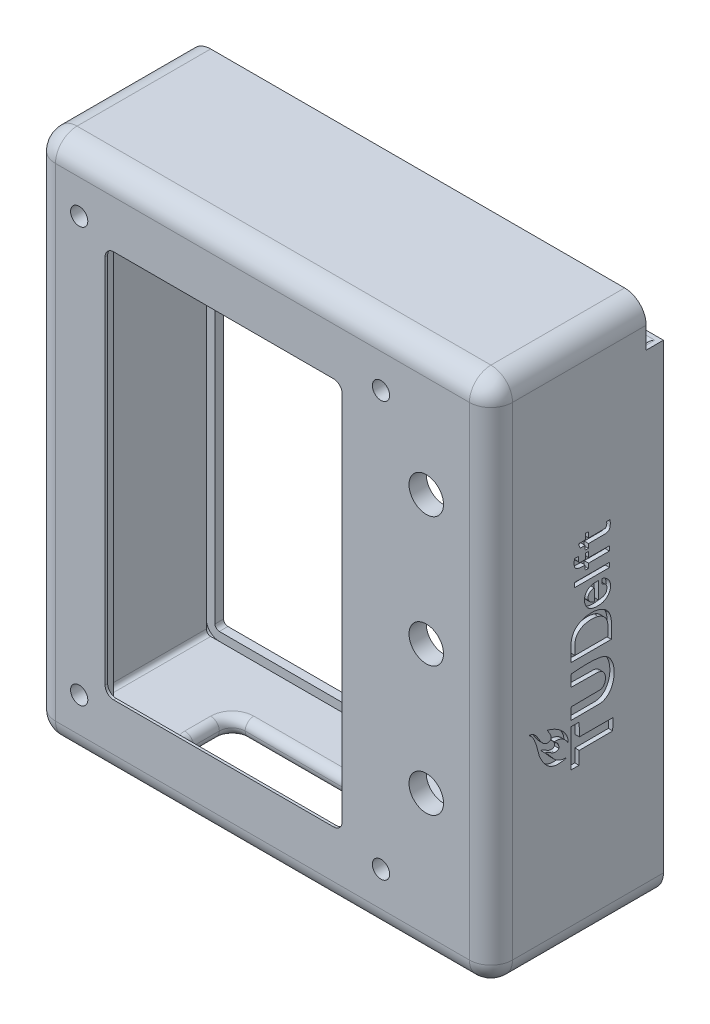
from build123d import *

# Parameters (mm, degrees)
BOSS_EXTRUDE1_DEPTH = 40
SHELL1_T            = -4
SKETCH4_R           = 4
SKETCH4_R_2         = 2
SKETCH4_W           = 59
SKETCH4_H           = 99
CUT_EXTRUDE2_DEPTH  = 10
FILLET10_R          = 5
SKETCH13_W          = 10
SKETCH13_H          = 114
BOSS_EXTRUDE5_DEPTH = 4.5
SKETCH14_R          = 1.65
CUT_EXTRUDE7_DEPTH  = 6
SKETCH17_W          = 102
SKETCH17_H          = 2
CUT_EXTRUDE10_DEPTH = 120
FILLET14_R          = 3
SKETCH18_W          = 98
SKETCH18_H          = 2
CUT_EXTRUDE11_DEPTH = 8.5
CUT_EXTRUDE15_DEPTH = 1
CUT_EXTRUDE13_DEPTH = 1
CUT_EXTRUDE14_DEPTH = 10
SKETCH28_W          = 59
SKETCH28_H          = 99
BOSS_EXTRUDE7_DEPTH = 0.6
SKETCH33_W          = 106
SKETCH33_H          = 2
CUT_EXTRUDE18_DEPTH = 10
SKETCH34_W          = 106
SKETCH34_H          = 2
CUT_EXTRUDE19_DEPTH = 10
FILLET16_R          = 1
FILLET17_R          = 2


with BuildPart() as part:
    # Sketch2 → Boss-Extrude1 (new body)
    with BuildSketch(Plane.XY):
        with BuildLine():
            Line((5, 0), (101, 0))
            ThreePointArc((101, 0), (104.535533906, 1.464466094), (106, 5))
            Line((106, 5), (106, 117))
            ThreePointArc((106, 117), (104.535533906, 120.535533906), (101, 122))
            Line((101, 122), (5, 122))
            ThreePointArc((5, 122), (1.464466094, 120.535533906), (0, 117))
            Line((0, 117), (0, 5))
            ThreePointArc((0, 5), (1.464466094, 1.464466094), (5, 0))
        make_face()
    extrude(amount=-BOSS_EXTRUDE1_DEPTH)

    # Shell1
    shell1_openings = [part.faces().sort_by_distance(p)[0] for p in [
        (53, 61, -40),
    ]]
    offset(amount=SHELL1_T, openings=shell1_openings, kind=Kind.INTERSECTION)

    # Sketch4 → Cut-Extrude2 (cut)
    with BuildSketch(Plane(origin=(0, 0, -4), x_dir=(-1, 0, 0), z_dir=(0, 0, -1))):
        with Locations((-91, 93.5)):
            Circle(SKETCH4_R)
        with Locations((-91, 63.5)):
            Circle(SKETCH4_R)
        with Locations((-91, 33.5)):
            Circle(SKETCH4_R)
        with Locations((-10.5, 13)):
            Circle(SKETCH4_R_2)
        with Locations((-80.5, 13)):
            Circle(SKETCH4_R_2)
        with Locations((-80.5, 109.15)):
            Circle(SKETCH4_R_2)
        with Locations((-10.5, 109.15)):
            Circle(SKETCH4_R_2)
        with Locations((-44, 58.5)):
            Rectangle(SKETCH4_W, SKETCH4_H)
    extrude(amount=-CUT_EXTRUDE2_DEPTH, mode=Mode.SUBTRACT)

    # Fillet10
    fillet10_edges = [part.edges().sort_by_distance(p)[0] for p in [
        (106, 61, 0),
        (104.535533906, 1.464466094, 0),
        (53, 0, 0),
        (1.464466094, 1.464466094, 0),
        (0, 61, 0),
        (1.464466094, 120.535533906, 0),
        (53, 122, 0),
        (104.535533906, 120.535533906, 0),
    ]]
    fillet(fillet10_edges, radius=FILLET10_R)

    # Sketch13 → Boss-Extrude5 (add)
    with BuildSketch(Plane.ZY.offset(-102)):
        with Locations((-9, 61)):
            Rectangle(SKETCH13_W, SKETCH13_H)
    extrude(amount=BOSS_EXTRUDE5_DEPTH)

    # Sketch14 → Cut-Extrude7 (cut)
    with BuildSketch(Plane(origin=(0, 0, -14), x_dir=(-1, 0, 0), z_dir=(0, 0, -1))):
        with Locations(Location((-99.5, 87.5, 0), (0, 0, 90))):
            Circle(SKETCH14_R)
        with Locations(Location((-99.5, 101.5, 0), (0, 0, 90))):
            Circle(SKETCH14_R)
        with Locations(Location((-99.5, 71.5, 0), (0, 0, 90))):
            Circle(SKETCH14_R)
        with Locations(Location((-99.5, 57.5, 0), (0, 0, 90))):
            Circle(SKETCH14_R)
        with Locations(Location((-99.5, 41.5, 0), (0, 0, 90))):
            Circle(SKETCH14_R)
        with Locations(Location((-99.5, 27.5, 0), (0, 0, 90))):
            Circle(SKETCH14_R)
    extrude(amount=-CUT_EXTRUDE7_DEPTH, mode=Mode.SUBTRACT)

    # Sketch17 → Cut-Extrude10 (cut)
    with BuildSketch(Plane(origin=(0, 122, 0), x_dir=(1, 0, 0), z_dir=(0, 1, 0))):
        with Locations((53, 37)):
            Rectangle(SKETCH17_W, SKETCH17_H)
    extrude(amount=-CUT_EXTRUDE10_DEPTH, mode=Mode.SUBTRACT)

    # Fillet14
    fillet14_edges = [part.edges().sort_by_distance(p)[0] for p in [
        (2, 2, -37),
        (104, 2, -37),
    ]]
    fillet(fillet14_edges, radius=FILLET14_R)

    # Sketch18 → Cut-Extrude11 (cut)
    with BuildSketch(Plane(origin=(0, 122, 0), x_dir=(1, 0, 0), z_dir=(0, 1, 0))):
        with Locations((53, 39)):
            Rectangle(SKETCH18_W, SKETCH18_H)
    extrude(amount=-CUT_EXTRUDE11_DEPTH, mode=Mode.SUBTRACT)

    # Sketch29 → Cut-Extrude15 (cut)
    # profile 1 of 7: a face of its own
    with BuildSketch(Plane.ZY):
        Polygon((-19.184615385, 79.668389423), (-19.184615385, 84.690384615), (-21.138461538, 84.690384615), (-21.138461538, 80.080528846), (-22.848076923, 80.080528846), (-22.848076923, 84.690384615), (-25.290384615, 84.690384615), (-25.290384615, 79.435606971), (-27, 79.435606971), (-27, 86.644230769), (-17.475, 86.644230769), (-17.475, 79.668389423), align=None)
    # profile 2 of 7: a face of its own
    with BuildSketch(Plane.ZY):
        with BuildLine():
            add(Edge.make_bspline(
                [(-19.795192308, 75.480213341), (-19.798414928, 75.378875026), (-19.804741596, 75.179927029), (-19.856714567, 74.890208346), (-19.945188898, 74.618168452), (-20.06812969, 74.366222124), (-20.21970016, 74.133175562), (-20.399719628, 73.923376558), (-20.606108876, 73.734353872), (-20.761718003, 73.630611151), (-20.840805288, 73.577884615)],
                knots=[0, 0, 0, 0, 1.070126732, 2.100879305, 3.097489192, 4.083234225, 5.054257209, 6.026534895, 6.996999713, 8, 8, 8, 8], degree=3))
            Line((-20.840805288, 73.577884615), (-17.475, 73.577884615))
            Line((-17.475, 73.577884615), (-17.475, 71.746153846))
            Line((-17.475, 71.746153846), (-27, 71.746153846))
            Line((-27, 71.746153846), (-27, 73.577884615))
            Line((-27, 73.577884615), (-26.015444712, 73.577884615))
            add(Edge.make_bspline(
                [(-26.015444712, 73.577884615), (-26.116760465, 73.641283604), (-26.312037416, 73.76347942), (-26.570438111, 73.973844639), (-26.786662137, 74.196602524), (-26.958497129, 74.437528107), (-27.089110245, 74.701560262), (-27.180260882, 74.992382426), (-27.233289925, 75.312285195), (-27.240494992, 75.534706261), (-27.244230769, 75.650030048)],
                knots=[0, 0, 0, 0, 1.126659371, 2.171534041, 3.134874904, 4.047216994, 4.951512989, 5.902213899, 6.912312383, 8, 8, 8, 8], degree=3))
            add(Edge.make_bspline(
                [(-27.244230769, 75.650030048), (-27.241589264, 75.747549822), (-27.236393908, 75.93935329), (-27.18654429, 76.220410581), (-27.107750531, 76.48969975), (-26.999975154, 76.748444962), (-26.85545235, 76.992735154), (-26.683102461, 77.226304799), (-26.47978733, 77.44899623), (-26.244920941, 77.654822733), (-25.988191568, 77.845151578), (-25.70860854, 78.009589964), (-25.413399026, 78.150996961), (-25.099860632, 78.266396693), (-24.768057068, 78.353558754), (-24.41899819, 78.415658062), (-24.052311923, 78.454923338), (-23.802204717, 78.459935869), (-23.674263822, 78.4625)],
                knots=[0, 0, 0, 0, 0.923362337, 1.816083982, 2.695276275, 3.578446321, 4.464306117, 5.377999886, 6.3250348, 7.315524922, 8.332896985, 9.34892933, 10.384086335, 11.430897423, 12.509764634, 13.630460556, 14.787875807, 16, 16, 16, 16], degree=3))
            add(Edge.make_bspline(
                [(-23.674263822, 78.4625), (-23.527894404, 78.459917745), (-23.242274092, 78.454878821), (-22.826001817, 78.41627175), (-22.433177526, 78.353794916), (-22.063918939, 78.266993029), (-21.718614166, 78.152967953), (-21.398996503, 78.010238844), (-21.100810076, 77.847106747), (-20.830173455, 77.656118163), (-20.588308827, 77.444051189), (-20.373323794, 77.217098732), (-20.194947289, 76.968698659), (-20.049891721, 76.703525166), (-19.932565053, 76.422829589), (-19.855011468, 76.123315222), (-19.802162944, 75.807724359), (-19.797552601, 75.591110239), (-19.795192308, 75.480213341)],
                knots=[0, 0, 0, 0, 1.27570574, 2.489368869, 3.640515872, 4.740475527, 5.792371709, 6.805039957, 7.78776411, 8.750630649, 9.685740783, 10.587928727, 11.469578384, 12.342997146, 13.218103404, 14.11376073, 15.034328495, 16, 16, 16, 16], degree=3))
        make_face()
        with BuildLine():
            add(Edge.make_bspline(
                [(-25.656730769, 75.125315505), (-25.654773554, 75.064173258), (-25.650941774, 74.94447075), (-25.624742834, 74.77062685), (-25.578289562, 74.60877088), (-25.514975689, 74.45776829), (-25.432490802, 74.317649766), (-25.330973974, 74.189301093), (-25.210430478, 74.074101884), (-25.074880215, 73.969182301), (-24.924380835, 73.876285231), (-24.761913747, 73.796284107), (-24.588662384, 73.729378047), (-24.404897402, 73.67427045), (-24.210548414, 73.630115311), (-24.005069435, 73.600550761), (-23.789783972, 73.580457347), (-23.642511366, 73.57875347), (-23.567412861, 73.577884615)],
                knots=[0, 0, 0, 0, 1.001779165, 1.961254029, 2.871652859, 3.754250832, 4.637156362, 5.527411399, 6.426527329, 7.362453559, 8.331221238, 9.319246845, 10.325568759, 11.370642018, 12.460279877, 13.587732286, 14.769915833, 16, 16, 16, 16], degree=3))
            add(Edge.make_bspline(
                [(-23.567412861, 73.577884615), (-23.463697837, 73.579852519), (-23.262903254, 73.583662424), (-22.973006222, 73.608904353), (-22.706435276, 73.657093259), (-22.463108133, 73.7215809), (-22.240989331, 73.802244784), (-22.044107061, 73.906693356), (-21.866643995, 74.02581656), (-21.767415526, 74.123261959), (-21.718509615, 74.171289062)],
                knots=[0, 0, 0, 0, 1.247550769, 2.415285928, 3.495710129, 4.501485712, 5.440734517, 6.330416986, 7.177126502, 8, 8, 8, 8], degree=3))
            add(Edge.make_bspline(
                [(-21.718509615, 74.171289062), (-21.666832064, 74.238268198), (-21.565136807, 74.370075147), (-21.460308872, 74.596324177), (-21.393875572, 74.837220908), (-21.386468525, 75.004023951), (-21.382692308, 75.0890625)],
                knots=[0, 0, 0, 0, 1.014857569, 1.997118619, 2.978902757, 4, 4, 4, 4], degree=3))
            add(Edge.make_bspline(
                [(-21.382692308, 75.0890625), (-21.384401112, 75.153414179), (-21.38771844, 75.278341087), (-21.416870148, 75.458990758), (-21.464253692, 75.626480678), (-21.531429777, 75.780689014), (-21.618052438, 75.921459051), (-21.724205146, 76.048501705), (-21.849460456, 76.16210117), (-21.993457021, 76.259906811), (-22.150080465, 76.347545218), (-22.317253038, 76.423743325), (-22.494643709, 76.485945527), (-22.679483087, 76.540789629), (-22.874605428, 76.578876732), (-23.07804254, 76.611039241), (-23.291111022, 76.62736747), (-23.436371514, 76.629623203), (-23.510171274, 76.630769231)],
                knots=[0, 0, 0, 0, 1.041173403, 2.021245978, 2.953250783, 3.852313722, 4.735255332, 5.619816304, 6.523641978, 7.463293026, 8.431339715, 9.426599799, 10.432928966, 11.472421043, 12.544643625, 13.64838667, 14.805260148, 16, 16, 16, 16], degree=3))
            add(Edge.make_bspline(
                [(-23.510171274, 76.630769231), (-23.589695556, 76.629665664), (-23.744487124, 76.627517607), (-23.970867534, 76.610976353), (-24.184533125, 76.579159764), (-24.387362298, 76.541285608), (-24.576565701, 76.486050046), (-24.75514029, 76.424980144), (-24.919828559, 76.347311578), (-25.072607863, 76.260538762), (-25.210482863, 76.161862108), (-25.330851417, 76.050480764), (-25.430437132, 75.924882683), (-25.513117113, 75.788330315), (-25.579115247, 75.639917783), (-25.624293124, 75.478611297), (-25.651143747, 75.305571861), (-25.654835251, 75.186471377), (-25.656730769, 75.125315505)],
                knots=[0, 0, 0, 0, 1.289049661, 2.50909551, 3.67547421, 4.7895128, 5.850182168, 6.867530038, 7.845350944, 8.796727448, 9.7123533, 10.587623181, 11.445786359, 12.301531035, 13.169300817, 14.069946094, 15.00895339, 16, 16, 16, 16], degree=3))
        make_face(mode=Mode.SUBTRACT)
    # profile 3 of 7: a face of its own
    with BuildSketch(Plane.ZY):
        with BuildLine():
            Line((-19.917307692, 68.204807692), (-24.202794471, 68.204807692))
            add(Edge.make_bspline(
                [(-24.202794471, 68.204807692), (-24.297658216, 68.203123357), (-24.475088099, 68.199973034), (-24.72272805, 68.173514845), (-24.935174198, 68.132115311), (-25.058170166, 68.081301433), (-25.11484375, 68.05788762)],
                knots=[0, 0, 0, 0, 1.222908122, 2.287285243, 3.210822222, 4, 4, 4, 4], degree=3))
            add(Edge.make_bspline(
                [(-25.11484375, 68.05788762), (-25.158371842, 68.035175381), (-25.24329202, 67.990865435), (-25.354271278, 67.900053463), (-25.447791423, 67.794779897), (-25.525972306, 67.674228377), (-25.584817877, 67.537300814), (-25.625959706, 67.384345142), (-25.653769369, 67.216806703), (-25.655722508, 67.099529146), (-25.656730769, 67.03898738)],
                knots=[0, 0, 0, 0, 0.960743248, 1.874341016, 2.793117903, 3.713417485, 4.679731242, 5.702591514, 6.814017171, 8, 8, 8, 8], degree=3))
            add(Edge.make_bspline(
                [(-25.656730769, 67.03898738), (-25.65490278, 66.960596199), (-25.651388504, 66.809890583), (-25.614186658, 66.593125457), (-25.554087107, 66.395682548), (-25.46840452, 66.217479975), (-25.362001403, 66.05596622), (-25.225342328, 65.918487401), (-25.067787519, 65.797793849), (-24.948659497, 65.736552532), (-24.887785457, 65.705258413)],
                knots=[0, 0, 0, 0, 1.149084102, 2.209093249, 3.215506793, 4.167091115, 5.101361966, 6.03837801, 6.997617415, 8, 8, 8, 8], degree=3))
            add(Edge.make_bspline(
                [(-24.887785457, 65.705258413), (-24.813412414, 65.675699586), (-24.656565859, 65.613362479), (-24.394127049, 65.561391973), (-24.100917146, 65.522963035), (-23.893852043, 65.519887195), (-23.784930889, 65.518269231)],
                knots=[0, 0, 0, 0, 0.851258892, 1.795234119, 2.840240881, 4, 4, 4, 4], degree=3))
            Line((-23.784930889, 65.518269231), (-19.917307692, 65.518269231))
            Line((-19.917307692, 65.518269231), (-19.917307692, 63.686538462))
            Line((-19.917307692, 63.686538462), (-27, 63.686538462))
            Line((-27, 63.686538462), (-27, 65.396153846))
            Line((-27, 65.396153846), (-26.015444712, 65.396153846))
            add(Edge.make_bspline(
                [(-26.015444712, 65.396153846), (-26.024280534, 65.402615477), (-26.046508669, 65.418870896), (-26.09054867, 65.445693348), (-26.150539088, 65.483911939), (-26.254299394, 65.545472449), (-26.389288697, 65.636578303), (-26.481185871, 65.730929335), (-26.526802885, 65.777764423)],
                knots=[0, 0, 0, 0, 0.307561016, 0.773726258, 1.448317077, 2.306767232, 4.166709159, 6, 6, 6, 6], degree=3))
            add(Edge.make_bspline(
                [(-26.526802885, 65.777764423), (-26.591593938, 65.849247195), (-26.715945558, 65.986442038), (-26.876304593, 66.200576781), (-27.000339352, 66.413376829), (-27.097910936, 66.624264691), (-27.16561395, 66.843895403), (-27.209317846, 67.077019275), (-27.239490087, 67.326960092), (-27.24261507, 67.499367439), (-27.244230769, 67.588506611)],
                knots=[0, 0, 0, 0, 1.154390067, 2.215587905, 3.194791368, 4.097601241, 4.990860715, 5.937383724, 6.933572677, 8, 8, 8, 8], degree=3))
            add(Edge.make_bspline(
                [(-27.244230769, 67.588506611), (-27.240687348, 67.71591366), (-27.233882809, 67.96057725), (-27.178799966, 68.312277053), (-27.084004493, 68.630894331), (-26.950837729, 68.917539436), (-26.782073258, 69.17398088), (-26.571193341, 69.394614336), (-26.323188836, 69.583827803), (-26.136099053, 69.678785341), (-26.040249399, 69.727433894)],
                knots=[0, 0, 0, 0, 1.171379334, 2.249434986, 3.263558756, 4.218762828, 5.146766563, 6.073626549, 7.013082238, 8, 8, 8, 8], degree=3))
            add(Edge.make_bspline(
                [(-26.040249399, 69.727433894), (-25.985297918, 69.752535858), (-25.871588206, 69.804478717), (-25.686188332, 69.866927177), (-25.48262132, 69.919341942), (-25.261056037, 69.963735034), (-25.021205466, 69.994441957), (-24.763625466, 70.020473842), (-24.486565591, 70.032350077), (-24.295658883, 70.035112093), (-24.197070313, 70.036538462)],
                knots=[0, 0, 0, 0, 0.769276275, 1.591843974, 2.488062962, 3.446313095, 4.468516516, 5.567486281, 6.743794526, 8, 8, 8, 8], degree=3))
            Line((-24.197070313, 70.036538462), (-19.917307692, 70.036538462))
            Line((-19.917307692, 70.036538462), (-19.917307692, 68.204807692))
        make_face()
    # profile 4 of 7: a face of its own
    with BuildSketch(Plane.ZY):
        with BuildLine():
            add(Edge.make_bspline(
                [(-20.556505409, 54.65), (-20.694638234, 54.652306363), (-20.961348512, 54.656759546), (-21.345213517, 54.697911096), (-21.699054434, 54.760387418), (-22.020378986, 54.854260249), (-22.311827896, 54.971961113), (-22.570972055, 55.117379685), (-22.800420138, 55.288438792), (-22.99563008, 55.48911555), (-23.163054459, 55.714420889), (-23.30797716, 55.96086543), (-23.430221478, 56.230438219), (-23.531232621, 56.520968773), (-23.609573163, 56.834493463), (-23.663762774, 57.170238187), (-23.696315115, 57.528608255), (-23.700652479, 57.77468416), (-23.702884615, 57.901322115)],
                knots=[0, 0, 0, 0, 1.269715031, 2.451597213, 3.545878933, 4.569310324, 5.523925967, 6.429940895, 7.294304972, 8.146214302, 8.994200311, 9.869807726, 10.770047517, 11.711459089, 12.694405657, 13.737564152, 14.835683444, 16, 16, 16, 16], degree=3))
            Line((-23.702884615, 57.901322115), (-23.702884615, 59.900961538))
            Line((-23.702884615, 59.900961538), (-27, 59.900961538))
            Line((-27, 59.900961538), (-27, 61.854807692))
            Line((-27, 61.854807692), (-17.475, 61.854807692))
            Line((-17.475, 61.854807692), (-17.475, 57.754402043))
            add(Edge.make_bspline(
                [(-17.475, 57.754402043), (-17.476861599, 57.639168324), (-17.480502014, 57.413825134), (-17.518690142, 57.085573755), (-17.574303552, 56.774323364), (-17.656118398, 56.481434648), (-17.763808447, 56.207018874), (-17.893881771, 55.949990517), (-18.046749084, 55.710450936), (-18.223135956, 55.489775539), (-18.422786497, 55.289087943), (-18.653311612, 55.119402037), (-18.906772119, 54.972535228), (-19.188157049, 54.85521299), (-19.493980376, 54.760914014), (-19.82623681, 54.698387901), (-20.182742256, 54.656760096), (-20.429173082, 54.652303006), (-20.556505409, 54.65)],
                knots=[0, 0, 0, 0, 1.107803273, 2.166344416, 3.174163336, 4.146339712, 5.085767764, 6.004962551, 6.912790486, 7.813667173, 8.717695093, 9.626696984, 10.558425905, 11.528714446, 12.552319343, 13.630821504, 14.775830874, 16, 16, 16, 16], degree=3))
        make_face()
        with BuildLine():
            add(Edge.make_bspline(
                [(-20.562229567, 56.603846154), (-20.502362836, 56.604585828), (-20.386751094, 56.606014252), (-20.220641016, 56.627012908), (-20.066310388, 56.652804978), (-19.927273255, 56.698586332), (-19.799272196, 56.750622006), (-19.686168951, 56.818320043), (-19.585675006, 56.896809119), (-19.469626293, 57.018983418), (-19.351241098, 57.202228636), (-19.252868818, 57.458812823), (-19.193550785, 57.752990098), (-19.187696141, 57.9614472), (-19.184615385, 58.071138822)],
                knots=[0, 0, 0, 0, 0.930183877, 1.796326194, 2.601357612, 3.358355334, 4.067445477, 4.745939225, 5.400884009, 6.044453304, 7.358443859, 8.761645878, 10.295954839, 12, 12, 12, 12], degree=3))
            Line((-19.184615385, 58.071138822), (-19.184615385, 59.900961538))
            Line((-19.184615385, 59.900961538), (-21.993269231, 59.900961538))
            Line((-21.993269231, 59.900961538), (-21.993269231, 58.071138822))
            add(Edge.make_bspline(
                [(-21.993269231, 58.071138822), (-21.992088087, 58.014497039), (-21.989800951, 57.904817343), (-21.974468427, 57.744702597), (-21.948704405, 57.594460203), (-21.909310218, 57.45387109), (-21.86303098, 57.322100773), (-21.803169213, 57.200596215), (-21.732033027, 57.089854552), (-21.652133638, 56.98762694), (-21.559484571, 56.89670663), (-21.453383658, 56.8182149), (-21.334994812, 56.751028888), (-21.20339986, 56.698909864), (-21.06194348, 56.652772669), (-20.905713691, 56.627034452), (-20.738334399, 56.606090658), (-20.622094232, 56.604609145), (-20.562229567, 56.603846154)],
                knots=[0, 0, 0, 0, 1.157083971, 2.240547754, 3.283033291, 4.266518188, 5.220107684, 6.132437237, 7.026352878, 7.905029121, 8.777922001, 9.669284267, 10.594385861, 11.549920919, 12.556817322, 13.627190485, 14.777983127, 16, 16, 16, 16], degree=3))
        make_face(mode=Mode.SUBTRACT)
    # profile 5 of 7: a face of its own
    with BuildSketch(Plane.ZY):
        with BuildLine():
            add(Edge.make_bspline(
                [(-22.808007812, 50.286283053), (-22.797021673, 50.206710525), (-22.776667441, 50.059284967), (-22.742025965, 49.856926435), (-22.70143694, 49.690625172), (-22.665670795, 49.594685499), (-22.649639423, 49.551682692)],
                knots=[0, 0, 0, 0, 1.279335821, 2.370250185, 3.269501206, 4, 4, 4, 4], degree=3))
            add(Edge.make_bspline(
                [(-22.649639423, 49.551682692), (-22.620775432, 49.491976366), (-22.56713145, 49.381011633), (-22.446610047, 49.24911033), (-22.298008897, 49.168118111), (-22.189478821, 49.159285118), (-22.134465144, 49.154807692)],
                knots=[0, 0, 0, 0, 1.145385502, 2.128709049, 3.051446389, 4, 4, 4, 4], degree=3))
            add(Edge.make_bspline(
                [(-22.134465144, 49.154807692), (-22.068365112, 49.157645196), (-21.943873207, 49.162989311), (-21.773979634, 49.22454535), (-21.634071769, 49.322355272), (-21.535284244, 49.467143136), (-21.467279223, 49.645449191), (-21.416384081, 49.857095361), (-21.386886342, 50.104833218), (-21.384149683, 50.281747779), (-21.382692308, 50.375961538)],
                knots=[0, 0, 0, 0, 0.965897861, 1.81915896, 2.614502876, 3.430446704, 4.347343387, 5.404533633, 6.617815053, 8, 8, 8, 8], degree=3))
            add(Edge.make_bspline(
                [(-21.382692308, 50.375961538), (-21.383850993, 50.430063264), (-21.386091408, 50.534673482), (-21.401472918, 50.685171143), (-21.425453132, 50.824009337), (-21.461599765, 50.949934174), (-21.507742514, 51.063745607), (-21.562436105, 51.166054466), (-21.629951348, 51.25513335), (-21.682819981, 51.305216393), (-21.708969351, 51.329987981)],
                knots=[0, 0, 0, 0, 1.248984466, 2.415016093, 3.489417099, 4.497974738, 5.43331642, 6.320501474, 7.169302748, 8, 8, 8, 8], degree=3))
            add(Edge.make_bspline(
                [(-21.708969351, 51.329987981), (-21.752043521, 51.361772195), (-21.840495817, 51.427040702), (-21.994006675, 51.503844884), (-22.169381282, 51.560193125), (-22.294428124, 51.584463284), (-22.359615385, 51.597115385)],
                knots=[0, 0, 0, 0, 0.901944212, 1.852131727, 2.880310388, 4, 4, 4, 4], degree=3))
            Line((-22.359615385, 51.597115385), (-22.359615385, 53.428846154))
            add(Edge.make_bspline(
                [(-22.359615385, 53.428846154), (-22.280626976, 53.422954056), (-22.125900102, 53.411412287), (-21.89994756, 53.375672222), (-21.684142357, 53.331087764), (-21.479358084, 53.271820075), (-21.285385564, 53.199095627), (-21.102697623, 53.112932239), (-20.929142889, 53.016561305), (-20.822950371, 52.940166737), (-20.770207332, 52.902223558)],
                knots=[0, 0, 0, 0, 1.118691807, 2.191355533, 3.229471641, 4.230560278, 5.200302684, 6.153074968, 7.082680764, 8, 8, 8, 8], degree=3))
            add(Edge.make_bspline(
                [(-20.770207332, 52.902223558), (-20.691661811, 52.837116822), (-20.53372358, 52.706201111), (-20.335356604, 52.465454629), (-20.16806222, 52.192600178), (-20.030807258, 51.887284087), (-19.92444348, 51.549039918), (-19.849130842, 51.178193302), (-19.803083404, 50.773996942), (-19.797888484, 50.493117735), (-19.795192308, 50.347340745)],
                knots=[0, 0, 0, 0, 0.862285428, 1.733871429, 2.626143069, 3.566140153, 4.560811269, 5.622301099, 6.765968497, 8, 8, 8, 8], degree=3))
            add(Edge.make_bspline(
                [(-19.795192308, 50.347340745), (-19.796442009, 50.250605926), (-19.798912788, 50.059352005), (-19.825105891, 49.776563865), (-19.86433024, 49.501849356), (-19.920613969, 49.235079326), (-19.989360876, 48.97612851), (-20.079524139, 48.72662882), (-20.180284656, 48.483575321), (-20.2632599, 48.329260592), (-20.304642428, 48.252298678)],
                knots=[0, 0, 0, 0, 1.064896591, 2.105401667, 3.124569576, 4.119013565, 5.106105961, 6.071874617, 7.038379406, 8, 8, 8, 8], degree=3))
            add(Edge.make_bspline(
                [(-20.304642428, 48.252298678), (-20.349111449, 48.179702925), (-20.436731185, 48.036663555), (-20.600439705, 47.848160819), (-20.788631563, 47.690125091), (-20.997872977, 47.558410865), (-21.232920881, 47.459613783), (-21.489041878, 47.386930035), (-21.768695593, 47.345479119), (-21.961969055, 47.339517525), (-22.061959135, 47.336433293)],
                knots=[0, 0, 0, 0, 0.977845014, 1.926701331, 2.855729463, 3.79540747, 4.758700572, 5.777461224, 6.850168949, 8, 8, 8, 8], degree=3))
            Line((-22.061959135, 47.336433293), (-25.225510817, 47.336433293))
            add(Edge.make_bspline(
                [(-25.225510817, 47.336433293), (-25.283391635, 47.336741321), (-25.404890465, 47.33738791), (-25.595664021, 47.33200787), (-25.803672458, 47.329204596), (-25.948030567, 47.325172867), (-26.023076923, 47.323076923)],
                knots=[0, 0, 0, 0, 0.870654108, 1.827608197, 2.87065514, 4, 4, 4, 4], degree=3))
            add(Edge.make_bspline(
                [(-26.023076923, 47.323076923), (-26.081091829, 47.319775659), (-26.186759185, 47.313762792), (-26.330021318, 47.289771647), (-26.445183908, 47.263146837), (-26.557362278, 47.208377434), (-26.668391091, 47.109845512), (-26.725547943, 47.009688234), (-26.755769231, 46.956730769)],
                knots=[0, 0, 0, 0, 1.199216845, 2.184233055, 3.000145829, 3.628917492, 4.746306586, 6, 6, 6, 6], degree=3))
            Line((-26.755769231, 46.956730769), (-27, 46.956730769))
            Line((-27, 46.956730769), (-27, 48.983082933))
            add(Edge.make_bspline(
                [(-27, 48.983082933), (-26.917767881, 49.008989688), (-26.760044061, 49.058679668), (-26.517807806, 49.104103068), (-26.268522392, 49.135022215), (-26.09693056, 49.14794984), (-26.005904447, 49.154807692)],
                knots=[0, 0, 0, 0, 1.021624659, 1.959508582, 2.917559194, 4, 4, 4, 4], degree=3))
            add(Edge.make_bspline(
                [(-26.005904447, 49.154807692), (-26.085141091, 49.219170699), (-26.242619912, 49.347088918), (-26.46027656, 49.558697531), (-26.662531716, 49.783002098), (-26.780678571, 49.945552026), (-26.839723558, 50.026787861)],
                knots=[0, 0, 0, 0, 1.011222501, 2.009753563, 3.005355878, 4, 4, 4, 4], degree=3))
            add(Edge.make_bspline(
                [(-26.839723558, 50.026787861), (-26.902423, 50.126729593), (-27.026906258, 50.325153569), (-27.150816492, 50.655497646), (-27.231341297, 51.002347825), (-27.239888269, 51.241113892), (-27.244230769, 51.36242488)],
                knots=[0, 0, 0, 0, 0.997301731, 1.980039463, 2.973709247, 4, 4, 4, 4], degree=3))
            add(Edge.make_bspline(
                [(-27.244230769, 51.36242488), (-27.243214541, 51.440117281), (-27.241225574, 51.592177246), (-27.212420282, 51.814596979), (-27.171757741, 52.027481196), (-27.111864498, 52.22953127), (-27.038560811, 52.422371488), (-26.943207653, 52.601924434), (-26.834429147, 52.773082004), (-26.709099013, 52.932747737), (-26.568245659, 53.078666213), (-26.410767781, 53.204895129), (-26.239805411, 53.312314122), (-26.055785042, 53.401093693), (-25.856607035, 53.467073692), (-25.644845796, 53.517309589), (-25.417724016, 53.545750525), (-25.261841098, 53.549191073), (-25.181625601, 53.550961538)],
                knots=[0, 0, 0, 0, 1.097748341, 2.148518655, 3.166171021, 4.159369777, 5.124652968, 6.077964498, 7.028429744, 7.989135819, 8.943083412, 9.889711825, 10.835357215, 11.792690014, 12.770997637, 13.796251028, 14.865976971, 16, 16, 16, 16], degree=3))
            add(Edge.make_bspline(
                [(-25.181625601, 53.550961538), (-25.07838376, 53.548423826), (-24.878346969, 53.543506868), (-24.590074679, 53.494455593), (-24.32291638, 53.416473171), (-24.077778025, 53.305988924), (-23.85460895, 53.162599963), (-23.655362492, 52.987235192), (-23.476592625, 52.780847389), (-23.380184632, 52.623888123), (-23.330814303, 52.543509615)],
                knots=[0, 0, 0, 0, 1.115790059, 2.161905088, 3.152248555, 4.118967279, 5.059710258, 6.010361337, 6.981110261, 8, 8, 8, 8], degree=3))
            add(Edge.make_bspline(
                [(-23.330814303, 52.543509615), (-23.304505502, 52.494954986), (-23.250208327, 52.39474596), (-23.182887735, 52.230264049), (-23.1179888, 52.051602027), (-23.058252574, 51.856335549), (-23.00849802, 51.644218847), (-22.959948278, 51.416725198), (-22.918336859, 51.172882777), (-22.89587417, 51.004424339), (-22.884329928, 50.917848558)],
                knots=[0, 0, 0, 0, 0.781113815, 1.612094545, 2.511948196, 3.471636916, 4.500010533, 5.594649795, 6.763819266, 8, 8, 8, 8], degree=3))
            Line((-22.884329928, 50.917848558), (-22.808007812, 50.286283053))
        make_face()
        with BuildLine():
            add(Edge.make_bspline(
                [(-23.569320913, 49.160531851), (-23.600110509, 49.220514665), (-23.660622882, 49.338401966), (-23.724064339, 49.494057317), (-23.764486376, 49.629085001), (-23.792491394, 49.747039809), (-23.819122899, 49.882088876), (-23.835411587, 49.977772492), (-23.844080529, 50.028695913)],
                knots=[0, 0, 0, 0, 1.324711271, 2.603523031, 3.295464343, 4.092720472, 4.984933851, 6, 6, 6, 6], degree=3))
            Line((-23.844080529, 50.028695913), (-23.914678486, 50.45609976))
            add(Edge.make_bspline(
                [(-23.914678486, 50.45609976), (-23.93031234, 50.549142805), (-23.95924491, 50.721331596), (-24.011893416, 50.955996148), (-24.067704771, 51.147890224), (-24.118929612, 51.255405515), (-24.141736779, 51.30327524)],
                knots=[0, 0, 0, 0, 1.285508128, 2.379007392, 3.278275014, 4, 4, 4, 4], degree=3))
            add(Edge.make_bspline(
                [(-24.141736779, 51.30327524), (-24.161217428, 51.336310087), (-24.199092456, 51.400537706), (-24.269366827, 51.485060481), (-24.345648041, 51.559089962), (-24.431544426, 51.618108567), (-24.525833396, 51.662971299), (-24.626785055, 51.694323415), (-24.735389036, 51.717425417), (-24.810695299, 51.718615542), (-24.849624399, 51.719230769)],
                knots=[0, 0, 0, 0, 1.061155753, 2.063139793, 3.035545394, 3.998642392, 4.936740835, 5.917733668, 6.92358549, 8, 8, 8, 8], degree=3))
            add(Edge.make_bspline(
                [(-24.849624399, 51.719230769), (-24.91609306, 51.716173551), (-25.041600439, 51.710400854), (-25.21643433, 51.661270656), (-25.3614376, 51.574859047), (-25.473223828, 51.455444249), (-25.554296546, 51.313392131), (-25.613836938, 51.156938252), (-25.651140507, 50.985728081), (-25.654833275, 50.866524903), (-25.656730769, 50.805273437)],
                knots=[0, 0, 0, 0, 1.151618787, 2.174508307, 3.114822681, 4.043415227, 4.978082406, 5.934884088, 6.938859042, 8, 8, 8, 8], degree=3))
            add(Edge.make_bspline(
                [(-25.656730769, 50.805273437), (-25.653277509, 50.706399156), (-25.646440611, 50.510644077), (-25.585123231, 50.223151846), (-25.483950043, 49.948627385), (-25.372372054, 49.729625137), (-25.258069392, 49.568817626), (-25.152236418, 49.464168445), (-25.03153503, 49.374205006), (-24.894115649, 49.299207807), (-24.740880805, 49.239912727), (-24.570656901, 49.199340387), (-24.385645638, 49.169863004), (-24.256341034, 49.163713592), (-24.189438101, 49.160531851)],
                knots=[0, 0, 0, 0, 1.424634298, 2.820545406, 4.216185285, 5.63573201, 6.351216174, 7.051668355, 7.772599332, 8.515597679, 9.302531378, 10.134519022, 11.034789597, 12, 12, 12, 12], degree=3))
            Line((-24.189438101, 49.160531851), (-23.569320913, 49.160531851))
        make_face(mode=Mode.SUBTRACT)
    # profile 6 of 7: a face of its own
    with BuildSketch(Plane.ZY):
        with BuildLine():
            add(Edge.make_bspline(
                [(-22.481730769, 41.705769231), (-22.419047984, 41.717011971), (-22.295720596, 41.739131885), (-22.117415735, 41.79787435), (-21.948645402, 41.877008314), (-21.846125389, 41.94727866), (-21.794831731, 41.982436899)],
                knots=[0, 0, 0, 0, 1.020784564, 2.008377456, 3.003534999, 4, 4, 4, 4], degree=3))
            add(Edge.make_bspline(
                [(-21.794831731, 41.982436899), (-21.761629078, 42.010889044), (-21.695863438, 42.067245188), (-21.610409725, 42.166362148), (-21.540296658, 42.277458464), (-21.482730189, 42.399411442), (-21.43653216, 42.531637734), (-21.404852081, 42.675091544), (-21.385149685, 42.829695757), (-21.383532108, 42.936399391), (-21.382692308, 42.991796875)],
                knots=[0, 0, 0, 0, 0.927730938, 1.837588673, 2.766891705, 3.709451669, 4.696271124, 5.735065912, 6.824110798, 8, 8, 8, 8], degree=3))
            add(Edge.make_bspline(
                [(-21.382692308, 42.991796875), (-21.384860431, 43.070239638), (-21.389037257, 43.221357309), (-21.432296285, 43.438701232), (-21.502331706, 43.636547269), (-21.601591065, 43.815796667), (-21.728333174, 43.97540046), (-21.884233408, 44.114406629), (-22.067513161, 44.234356691), (-22.204677954, 44.294435115), (-22.275661058, 44.325525841)],
                knots=[0, 0, 0, 0, 1.094180442, 2.107906356, 3.079923282, 4.014160969, 4.955966861, 5.91186353, 6.919384453, 8, 8, 8, 8], degree=3))
            add(Edge.make_bspline(
                [(-22.275661058, 44.325525841), (-22.362877741, 44.354940816), (-22.547840118, 44.417321812), (-22.853275076, 44.472085378), (-23.196930958, 44.509599852), (-23.439446525, 44.51275711), (-23.567412861, 44.514423077)],
                knots=[0, 0, 0, 0, 0.840821226, 1.783148432, 2.830250876, 4, 4, 4, 4], degree=3))
            add(Edge.make_bspline(
                [(-23.567412861, 44.514423077), (-23.689028701, 44.512750036), (-23.92014177, 44.509570668), (-24.247871579, 44.471896827), (-24.540454915, 44.417667142), (-24.716686769, 44.353811059), (-24.800015024, 44.323617788)],
                knots=[0, 0, 0, 0, 1.162699392, 2.209539676, 3.153411088, 4, 4, 4, 4], degree=3))
            add(Edge.make_bspline(
                [(-24.800015024, 44.323617788), (-24.867942538, 44.293938219), (-24.999858842, 44.236300027), (-25.174012629, 44.116776526), (-25.326691288, 43.98387906), (-25.447144386, 43.826438525), (-25.54306736, 43.651781572), (-25.608647411, 43.457323148), (-25.650019702, 43.244132025), (-25.654435575, 43.095672805), (-25.656730769, 43.018509615)],
                knots=[0, 0, 0, 0, 1.062283379, 2.062971077, 3.020279789, 3.957595583, 4.893619787, 5.869999752, 6.892910715, 8, 8, 8, 8], degree=3))
            add(Edge.make_bspline(
                [(-25.656730769, 43.018509615), (-25.655523242, 42.963779335), (-25.653187517, 42.857914342), (-25.638434293, 42.705306375), (-25.612304118, 42.565204041), (-25.573668793, 42.438215145), (-25.525976307, 42.323043523), (-25.469372158, 42.218777423), (-25.399511684, 42.127725871), (-25.291726053, 42.02358252), (-25.13418682, 41.917279346), (-24.924369551, 41.815062512), (-24.688808281, 41.741707572), (-24.52191321, 41.71802199), (-24.435576923, 41.705769231)],
                knots=[0, 0, 0, 0, 0.976560142, 1.888964051, 2.732498075, 3.515129688, 4.252778793, 4.953815319, 5.625677932, 6.291765114, 7.62030924, 8.995767327, 10.445884044, 12, 12, 12, 12], degree=3))
            Line((-24.435576923, 41.705769231), (-24.435576923, 39.874038462))
            add(Edge.make_bspline(
                [(-24.435576923, 39.874038462), (-24.505727089, 39.880345927), (-24.645628095, 39.892924954), (-24.85227622, 39.935537489), (-25.056832973, 39.987510916), (-25.257530868, 40.057922825), (-25.457086935, 40.138482206), (-25.651177892, 40.239880567), (-25.845004091, 40.350997519), (-25.968360521, 40.437219634), (-26.030709135, 40.480799279)],
                knots=[0, 0, 0, 0, 0.977261134, 1.948959257, 2.925781307, 3.906110522, 4.900030829, 5.911184547, 6.944240298, 8, 8, 8, 8], degree=3))
            add(Edge.make_bspline(
                [(-26.030709135, 40.480799279), (-26.127645209, 40.554628308), (-26.318826251, 40.70023675), (-26.565753185, 40.960316976), (-26.777937666, 41.243027796), (-26.948408378, 41.554657097), (-27.083392279, 41.889932466), (-27.175155714, 42.25262838), (-27.234303651, 42.640043186), (-27.24085928, 42.907613702), (-27.244230769, 43.045222356)],
                knots=[0, 0, 0, 0, 0.988134944, 1.948837625, 2.901271395, 3.851433691, 4.82493564, 5.828394326, 6.883166437, 8, 8, 8, 8], degree=3))
            add(Edge.make_bspline(
                [(-27.244230769, 43.045222356), (-27.241906115, 43.182153429), (-27.237391589, 43.448076412), (-27.185382617, 43.831519232), (-27.109393804, 44.189151161), (-26.996479107, 44.517339554), (-26.85322766, 44.819746666), (-26.674074517, 45.090852743), (-26.466961826, 45.337628246), (-26.224355132, 45.550149783), (-25.95800057, 45.735683415), (-25.675660442, 45.901363488), (-25.374046488, 46.038425445), (-25.055595657, 46.151731141), (-24.719585123, 46.23853033), (-24.366372421, 46.302228511), (-23.995547022, 46.337760439), (-23.742389883, 46.343317917), (-23.61320613, 46.346153846)],
                knots=[0, 0, 0, 0, 1.177156206, 2.286061753, 3.322822893, 4.317722961, 5.264773922, 6.193503842, 7.105646802, 8.028021187, 8.958554405, 9.895100176, 10.840125967, 11.804032814, 12.799339004, 13.822131939, 14.88865402, 16, 16, 16, 16], degree=3))
            add(Edge.make_bspline(
                [(-23.61320613, 46.346153846), (-23.468076743, 46.34394138), (-23.185443077, 46.339632691), (-22.773594123, 46.296015581), (-22.385246225, 46.229164283), (-22.021373829, 46.131573064), (-21.681552449, 46.007236192), (-21.364903886, 45.856887095), (-21.072822514, 45.676787778), (-20.807985985, 45.467946344), (-20.568470415, 45.237919414), (-20.360737133, 44.984367115), (-20.186297791, 44.709062967), (-20.04192715, 44.413730072), (-19.932040971, 44.09689107), (-19.851290278, 43.760272089), (-19.803054256, 43.402159703), (-19.797855506, 43.156039542), (-19.795192308, 43.029957933)],
                knots=[0, 0, 0, 0, 1.216174426, 2.368450963, 3.467650265, 4.516510274, 5.521821814, 6.497166983, 7.45001556, 8.391791627, 9.319334404, 10.228647329, 11.132347255, 12.045606105, 12.978085134, 13.937607724, 14.943484617, 16, 16, 16, 16], degree=3))
            add(Edge.make_bspline(
                [(-19.795192308, 43.029957933), (-19.797163451, 42.9224244), (-19.801018691, 42.712106074), (-19.827112259, 42.403345555), (-19.875011008, 42.110211942), (-19.940352019, 41.831733667), (-20.020888102, 41.567171374), (-20.125114642, 41.318982971), (-20.245254907, 41.0847995), (-20.384071613, 40.865745538), (-20.547816098, 40.664423263), (-20.739667251, 40.483963145), (-20.961050693, 40.327164887), (-21.21091916, 40.193148729), (-21.487558122, 40.078856613), (-21.794010065, 39.988000796), (-22.127793318, 39.917352776), (-22.361244098, 39.888783433), (-22.481730769, 39.874038462)],
                knots=[0, 0, 0, 0, 1.106029885, 2.163216879, 3.183825836, 4.158098972, 5.103662189, 6.024531847, 6.922747049, 7.808295155, 8.686954375, 9.584764519, 10.508719332, 11.468833984, 12.495379681, 13.581872002, 14.75197593, 16, 16, 16, 16], degree=3))
            Line((-22.481730769, 39.874038462), (-22.481730769, 41.705769231))
        make_face()
    # profile 7 of 7: a face of its own
    with BuildSketch(Plane.ZY):
        with BuildLine():
            add(Edge.make_bspline(
                [(-19.795192308, 35.792713341), (-19.799470709, 35.64943399), (-19.807855914, 35.368621922), (-19.866450083, 34.957186776), (-19.971110831, 34.568955617), (-20.087867236, 34.260745335), (-20.204912219, 34.029779913), (-20.303048029, 33.863614282), (-20.413039107, 33.70575005), (-20.536830761, 33.556438993), (-20.669329718, 33.412945246), (-20.816402775, 33.278929606), (-20.973169277, 33.151198852), (-21.085736633, 33.074234861), (-21.142277644, 33.035576923)],
                knots=[0, 0, 0, 0, 1.608362333, 3.15221661, 4.651988969, 6.114453022, 6.842462457, 7.556330322, 8.279280659, 8.999652744, 9.732129822, 10.469842536, 11.231423273, 12, 12, 12, 12], degree=3))
            add(Edge.make_bspline(
                [(-21.142277644, 33.035576923), (-21.247743066, 32.970069562), (-21.460457496, 32.837947009), (-21.808813086, 32.684562906), (-22.181242898, 32.566212541), (-22.44098568, 32.519431552), (-22.573317308, 32.495597957)],
                knots=[0, 0, 0, 0, 0.965490094, 1.94730814, 2.954211348, 4, 4, 4, 4], degree=3))
            add(Edge.make_bspline(
                [(-22.573317308, 32.495597957), (-22.661627786, 32.484386725), (-22.854900687, 32.459850256), (-23.172912242, 32.444060349), (-23.542537544, 32.433680282), (-23.806544746, 32.436731663), (-23.947115385, 32.43835637)],
                knots=[0, 0, 0, 0, 0.77593598, 1.698183515, 2.774397778, 4, 4, 4, 4], degree=3))
            Line((-23.947115385, 32.43835637), (-23.947115385, 37.309615385))
            add(Edge.make_bspline(
                [(-23.947115385, 37.309615385), (-24.029986889, 37.304988936), (-24.190915102, 37.296004833), (-24.421207858, 37.254529127), (-24.633804513, 37.198943648), (-24.825885861, 37.119992066), (-24.999359809, 37.022394855), (-25.153418853, 36.905544201), (-25.287562681, 36.768171003), (-25.36045944, 36.663881623), (-25.397235577, 36.611268029)],
                knots=[0, 0, 0, 0, 1.186462669, 2.303992399, 3.341523905, 4.325013182, 5.266342964, 6.181807089, 7.08272862, 8, 8, 8, 8], degree=3))
            add(Edge.make_bspline(
                [(-25.397235577, 36.611268029), (-25.436998545, 36.542385354), (-25.517667931, 36.402639168), (-25.598841076, 36.168359222), (-25.646614438, 35.914244953), (-25.653294758, 35.738232844), (-25.656730769, 35.647701322)],
                knots=[0, 0, 0, 0, 0.942300318, 1.911698055, 2.925885537, 4, 4, 4, 4], degree=3))
            add(Edge.make_bspline(
                [(-25.656730769, 35.647701322), (-25.653347277, 35.552591831), (-25.646857458, 35.370163903), (-25.589761157, 35.110914039), (-25.500812876, 34.87658635), (-25.408294976, 34.743650458), (-25.362890625, 34.678410457)],
                knots=[0, 0, 0, 0, 1.105702343, 2.120829232, 3.077772742, 4, 4, 4, 4], degree=3))
            add(Edge.make_bspline(
                [(-25.362890625, 34.678410457), (-25.334176292, 34.645474881), (-25.275284363, 34.577925354), (-25.173794262, 34.483353397), (-25.054140102, 34.398574947), (-24.968256384, 34.346505096), (-24.924038462, 34.319696514)],
                knots=[0, 0, 0, 0, 0.919502588, 1.885862442, 2.911519263, 4, 4, 4, 4], degree=3))
            Line((-24.924038462, 34.319696514), (-24.924038462, 32.547115385))
            add(Edge.make_bspline(
                [(-24.924038462, 32.547115385), (-24.977042782, 32.554233439), (-25.08422131, 32.568626655), (-25.243865852, 32.612150638), (-25.403255266, 32.672088371), (-25.564921975, 32.744144327), (-25.72577913, 32.835210492), (-25.887302152, 32.942169308), (-26.050008755, 33.064292098), (-26.154641645, 33.155121277), (-26.208158053, 33.201577524)],
                knots=[0, 0, 0, 0, 0.875750056, 1.770829253, 2.70418088, 3.665237135, 4.668609322, 5.729669911, 6.838798097, 8, 8, 8, 8], degree=3))
            add(Edge.make_bspline(
                [(-26.208158053, 33.201577524), (-26.290926276, 33.278530688), (-26.455915782, 33.431928504), (-26.666900611, 33.695178747), (-26.846500714, 33.979957169), (-26.991285236, 34.288030385), (-27.107305431, 34.617522029), (-27.185126121, 34.971283448), (-27.237219096, 35.346584805), (-27.241853818, 35.604900641), (-27.244230769, 35.737379808)],
                knots=[0, 0, 0, 0, 0.957812751, 1.90929619, 2.852526618, 3.808376433, 4.791380331, 5.809825916, 6.87675319, 8, 8, 8, 8], degree=3))
            add(Edge.make_bspline(
                [(-27.244230769, 35.737379808), (-27.241683566, 35.84815635), (-27.236659859, 36.066634796), (-27.196161376, 36.3894032), (-27.12581459, 36.70152076), (-27.034493479, 37.005462224), (-26.909651916, 37.297557328), (-26.760948385, 37.580650635), (-26.584663967, 37.853882845), (-26.382980453, 38.115884413), (-26.152558578, 38.360572573), (-25.880761489, 38.569340046), (-25.577635133, 38.747511826), (-25.2403995, 38.892806036), (-24.869700228, 39.005053411), (-24.464926081, 39.083148787), (-24.027295235, 39.134442405), (-23.724028276, 39.138995045), (-23.567412861, 39.141346154)],
                knots=[0, 0, 0, 0, 0.937042255, 1.848076587, 2.746308114, 3.641585269, 4.529033897, 5.429245701, 6.344212528, 7.276297672, 8.223909909, 9.178645319, 10.165180116, 11.191813607, 12.277778975, 13.435433316, 14.675587091, 16, 16, 16, 16], degree=3))
            add(Edge.make_bspline(
                [(-23.567412861, 39.141346154), (-23.419781486, 39.138141747), (-23.132805738, 39.131912805), (-22.714989963, 39.091634658), (-22.324437074, 39.015464912), (-21.958444527, 38.917097756), (-21.621191134, 38.783600753), (-21.307959541, 38.625655731), (-21.023843924, 38.434088397), (-20.766407085, 38.215279244), (-20.539248677, 37.973250063), (-20.337578717, 37.714896953), (-20.171959349, 37.435514479), (-20.033308653, 37.140692173), (-19.926296087, 36.827725794), (-19.850417252, 36.497829741), (-19.803485883, 36.15086959), (-19.797994079, 35.913707213), (-19.795192308, 35.792713341)],
                knots=[0, 0, 0, 0, 1.242403444, 2.41506698, 3.526649178, 4.587508088, 5.599263789, 6.573461252, 7.533859354, 8.475447478, 9.410579445, 10.32263732, 11.227648763, 12.13748983, 13.059915525, 14.005025887, 14.982217816, 16, 16, 16, 16], degree=3))
        make_face()
        with BuildLine():
            add(Edge.make_bspline(
                [(-21.382692308, 35.779356971), (-21.383748053, 35.834731628), (-21.38580425, 35.942580724), (-21.402998582, 36.099646699), (-21.432212712, 36.24672872), (-21.468621199, 36.38508102), (-21.521770992, 36.51232482), (-21.583981436, 36.630136198), (-21.657636272, 36.739415473), (-21.771929219, 36.870227945), (-21.939492779, 37.013562729), (-22.170749856, 37.153078187), (-22.437188392, 37.252422133), (-22.627332616, 37.290081336), (-22.725961538, 37.309615385)],
                knots=[0, 0, 0, 0, 0.884344303, 1.722371564, 2.519306431, 3.278437536, 4.002856082, 4.716365384, 5.403871904, 6.102472158, 7.485343547, 8.907000398, 10.395643002, 12, 12, 12, 12], degree=3))
            Line((-22.725961538, 37.309615385), (-22.725961538, 34.256730769))
            add(Edge.make_bspline(
                [(-22.725961538, 34.256730769), (-22.672373991, 34.261323138), (-22.567658012, 34.270297133), (-22.41746987, 34.302331483), (-22.276163272, 34.341137786), (-22.146033848, 34.395351384), (-22.025088122, 34.460347837), (-21.913056111, 34.536984879), (-21.812532465, 34.626773342), (-21.692000539, 34.760288734), (-21.567951539, 34.950081117), (-21.459870068, 35.204466342), (-21.393364117, 35.484055968), (-21.386314416, 35.679129132), (-21.382692308, 35.779356971)],
                knots=[0, 0, 0, 0, 0.853488581, 1.667810829, 2.435221393, 3.178169035, 3.901416303, 4.613212647, 5.328870095, 6.037000511, 7.466031695, 8.905346501, 10.409978964, 12, 12, 12, 12], degree=3))
        make_face(mode=Mode.SUBTRACT)
    extrude(amount=-CUT_EXTRUDE15_DEPTH, mode=Mode.SUBTRACT)

    # Sketch21 → Cut-Extrude13 (cut)
    # profile 1 of 8: a face of its own
    with BuildSketch(Plane(origin=(106, 0, 0), x_dir=(0, 0, -1), z_dir=(1, 0, 0))):
        Polygon((18.56579334, 36.393750112), (18.59651334, 45.087510112), (20.47043334, 45.056790112), (20.50115334, 42.076950112), (28.27331334, 42.046230112), (28.24259334, 39.404310112), (20.47043334, 39.373590112), (20.43971334, 36.393750112), align=None)
    # profile 2 of 8: a face of its own
    with BuildSketch(Plane(origin=(106, 0, 0), x_dir=(0, 0, -1), z_dir=(1, 0, 0))):
        with BuildLine():
            Line((8.88899334, 48.005910112), (8.95043334, 48.159510112))
            add(Edge.make_bspline(
                [(8.95043334, 48.159510112), (10.844703637, 48.033225425), (11.044500005, 45.404361276), (12.63683334, 44.626710112), (12.822918751, 44.53583119), (13.046812498, 44.501400786), (13.25123334, 44.534550112), (14.797859413, 44.78535434), (13.397309931, 46.484956932), (13.12835334, 47.022870112)],
                knots=[0, 0, 0, 0, 1, 1, 1, 2, 2, 2, 3, 3, 3, 3], degree=3))
            Line((13.12835334, 47.022870112), (13.18979334, 47.084310112))
            add(Edge.make_bspline(
                [(13.18979334, 47.084310112), (15.464934559, 46.494458685), (18.043826611, 44.632448795), (17.92067334, 42.046230112)],
                knots=[0, 0, 0, 0, 1, 1, 1, 1], degree=3))
            ThreePointArc((17.92067334, 42.046230112), (16.633163049, 43.562948539), (14.69507334, 44.012310112))
            Line((14.69507334, 44.012310112), (14.69507334, 43.920150112))
            add(Edge.make_bspline(
                [(14.69507334, 43.920150112), (15.491195554, 43.341152138), (15.72734898, 43.125650396), (15.77027334, 42.138390112)],
                knots=[0, 0, 0, 0, 1, 1, 1, 1], degree=3))
            add(Edge.make_bspline(
                [(15.77027334, 42.138390112), (14.687477908, 41.154030628), (13.662084421, 42.603238306), (12.51395334, 42.844950112)],
                knots=[0, 0, 0, 0, 1, 1, 1, 1], degree=3))
            add(Edge.make_bspline(
                [(12.51395334, 42.844950112), (14.56130466, 41.098679869), (14.537989132, 39.60643327), (17.36771334, 39.404310112)],
                knots=[0, 0, 0, 0, 1, 1, 1, 1], degree=3))
            Line((17.36771334, 39.404310112), (17.36771334, 39.281430112))
            add(Edge.make_bspline(
                [(17.36771334, 39.281430112), (15.549774252, 38.933314116), (14.120231104, 38.853874499), (12.75971334, 40.325910112), (12.049283275, 41.094572149), (11.51193773, 42.042717012), (11.16227334, 43.029270112), (11.056847195, 43.32672245), (10.223689946, 47.672235961), (8.88899334, 48.005910112)],
                knots=[0, 0, 0, 0, 1, 1, 1, 2, 2, 2, 3, 3, 3, 3], degree=3))
        make_face()
    # profile 3 of 8: a face of its own
    with BuildSketch(Plane(origin=(106, 0, 0), x_dir=(0, 0, -1), z_dir=(1, 0, 0))):
        with BuildLine():
            Line((18.56579334, 46.347030112), (18.62723334, 49.050390112))
            add(Edge.make_bspline(
                [(18.62723334, 49.050390112), (20.79811334, 49.070870112), (22.969110031, 49.081398851), (25.13987334, 49.111830112), (26.965853424, 49.137427964), (26.985875101, 52.163719043), (25.47779334, 52.736790112), (25.184940826, 52.848074067), (24.869279261, 52.909978168), (24.55619334, 52.921110112), (22.560549363, 52.992066342), (20.56259334, 52.962070112), (18.56579334, 52.982550112)],
                knots=[0, 0, 0, 0, 1, 1, 1, 2, 2, 2, 3, 3, 3, 4, 4, 4, 4], degree=3))
            Line((18.56579334, 52.982550112), (18.62723334, 55.655190112))
            add(Edge.make_bspline(
                [(18.62723334, 55.655190112), (18.864915635, 55.653058432), (24.435501745, 56.323410952), (26.52227334, 55.225110112), (29.243853011, 53.792699759), (29.254309775, 48.343758219), (26.61443334, 46.807830112), (25.801481735, 46.334840087), (25.242701676, 46.359482547), (24.27971334, 46.347030112), (22.375232559, 46.322403205), (20.47043334, 46.347030112), (18.56579334, 46.347030112)],
                knots=[0, 0, 0, 0, 1, 1, 1, 2, 2, 2, 3, 3, 3, 4, 4, 4, 4], degree=3))
        make_face()
    # profile 4 of 8: a face of its own
    with BuildSketch(Plane(origin=(106, 0, 0), x_dir=(0, 0, -1), z_dir=(1, 0, 0))):
        with BuildLine():
            Line((27.921690538, 57.955290897), (18.546232147, 57.955290897))
            add(Edge.make_bspline(
                [(18.546232147, 57.955290897), (18.556121871, 59.270624194), (18.55627111, 60.586066799), (18.575901319, 61.901290789), (18.576110045, 61.915275414), (18.603443792, 61.917136415), (18.605570491, 61.930959961), (18.623678684, 62.048663217), (18.61713147, 62.169286771), (18.635239663, 62.286990027), (18.637366363, 62.300813573), (18.661763909, 62.303031186), (18.664908835, 62.316659199), (18.691962511, 62.433891795), (18.697193503, 62.555456668), (18.724247179, 62.672689264), (18.727392105, 62.686317277), (18.749493533, 62.689089979), (18.753916352, 62.702358437), (18.799452061, 62.838965564), (18.827057331, 62.981119719), (18.87259304, 63.117726846), (18.877015859, 63.130995303), (18.896007402, 63.134886397), (18.902262212, 63.147396018), (18.995246658, 63.33336491), (19.076300316, 63.525141398), (19.169284761, 63.711110289), (19.175539572, 63.72361991), (19.190933385, 63.729321534), (19.198953933, 63.740779461), (19.260299335, 63.828415748), (19.315623565, 63.920165723), (19.376968966, 64.00780201), (19.635898475, 64.377701308), (20.038019743, 64.662020769), (20.415389991, 64.897877174), (20.566684142, 64.992436019), (20.747459391, 65.103758698), (20.919765917, 65.164899723), (21.39783869, 65.334538449), (21.892612617, 65.506832226), (22.403224523, 65.55059896), (22.935409796, 65.596214841), (23.472796463, 65.621234544), (24.005359818, 65.580268133), (24.019304803, 65.579195441), (24.021183376, 65.552576905), (24.03502899, 65.55059896), (24.16267924, 65.53236321), (24.293077977, 65.539165538), (24.420728227, 65.520929788), (24.434573841, 65.518951843), (24.436721677, 65.494191128), (24.450397399, 65.491260616), (24.57758897, 65.46400528), (24.708905066, 65.459177608), (24.836096637, 65.431922272), (24.849772359, 65.42899176), (24.852497352, 65.406675919), (24.865765809, 65.4022531), (25.061672231, 65.336950959), (25.26324283, 65.289540208), (25.459149252, 65.224238067), (25.472417709, 65.219815248), (25.476308802, 65.200823706), (25.488818424, 65.194568895), (25.87049375, 65.003731232), (26.24662115, 64.866289377), (26.55690862, 64.57151628), (26.884285403, 64.260508336), (27.16797302, 63.984705777), (27.38764544, 63.5924336), (27.817069251, 62.825605366), (27.94494636, 61.906687093), (27.95135971, 61.040884798), (27.958978604, 60.012334169), (27.931580262, 58.983822197), (27.921690538, 57.955290897)],
                knots=[0, 0, 0, 0, 1, 1, 1, 2, 2, 2, 3, 3, 3, 4, 4, 4, 5, 5, 5, 6, 6, 6, 7, 7, 7, 8, 8, 8, 9, 9, 9, 10, 10, 10, 11, 11, 11, 12, 12, 12, 13, 13, 13, 14, 14, 14, 15, 15, 15, 16, 16, 16, 17, 17, 17, 18, 18, 18, 19, 19, 19, 20, 20, 20, 21, 21, 21, 22, 22, 22, 23, 23, 23, 24, 24, 24, 25, 25, 25, 26, 26, 26, 26], degree=3))
        make_face()
        with BuildLine():
            Line((27.111736393, 58.937816722), (19.482038023, 58.937816722))
            add(Edge.make_bspline(
                [(19.482038023, 58.937816722), (19.495790043, 60.106738421), (19.239331915, 61.621517787), (19.898786253, 62.72060835), (20.397718273, 63.552161718), (21.334051315, 64.044127855), (22.27104541, 64.195255935), (22.462105208, 64.226072031), (22.656046864, 64.235366727), (22.848081421, 64.259371047), (22.912578987, 64.267433243), (22.975427258, 64.291428603), (23.040426758, 64.291428603), (23.720985519, 64.291428603), (24.298672868, 64.256970621), (24.931822573, 64.06702571), (24.946297317, 64.062683287), (24.949677898, 64.040132601), (24.963880129, 64.034968154), (25.068726839, 63.996842077), (25.17960898, 63.976921562), (25.284455691, 63.938795485), (25.298657921, 63.933631038), (25.302996594, 63.913496255), (25.316513247, 63.906737929), (25.619309703, 63.755339701), (25.897165731, 63.628600722), (26.150009707, 63.39381703), (26.302567897, 63.252155854), (26.523009715, 63.046588023), (26.63087305, 62.848838575), (26.817696286, 62.506329309), (27.033634498, 62.097654516), (27.079678836, 61.694766553), (27.112528827, 61.407329138), (27.140430124, 61.118501447), (27.143793949, 60.829212536), (27.151125498, 60.198699337), (27.122422245, 59.568281993), (27.111736393, 58.937816722)],
                knots=[0, 0, 0, 0, 1, 1, 1, 2, 2, 2, 3, 3, 3, 4, 4, 4, 5, 5, 5, 6, 6, 6, 7, 7, 7, 8, 8, 8, 9, 9, 9, 10, 10, 10, 11, 11, 11, 12, 12, 12, 13, 13, 13, 13], degree=3))
        make_face(mode=Mode.SUBTRACT)
    # profile 5 of 8: a face of its own
    with BuildSketch(Plane(origin=(106, 0, 0), x_dir=(0, 0, -1), z_dir=(1, 0, 0))):
        with BuildLine():
            Line((24.92041244, 71.256641058), (24.97161244, 67.314241058))
            add(Edge.make_bspline(
                [(24.97161244, 67.314241058), (25.674964812, 67.437327723), (26.636266975, 67.462198586), (26.84041244, 68.363841058), (27.063162082, 69.347651977), (26.63789495, 69.828585116), (25.76521244, 70.155841058)],
                knots=[0, 0, 0, 0, 1, 1, 1, 2, 2, 2, 2], degree=3))
            Line((25.76521244, 70.155841058), (25.79081244, 71.256641058))
            add(Edge.make_bspline(
                [(25.79081244, 71.256641058), (28.783515355, 70.321421397), (28.19425357, 66.359475531), (25.02281244, 66.239041058), (24.394012409, 66.215162576), (23.610229614, 66.265366475), (23.02601244, 66.571841058), (21.538187542, 67.352339365), (21.15761495, 69.750801222), (22.59081244, 70.795841058), (23.295376724, 71.309585848), (24.096858531, 71.317645051), (24.92041244, 71.256641058)],
                knots=[0, 0, 0, 0, 1, 1, 1, 2, 2, 2, 3, 3, 3, 4, 4, 4, 4], degree=3))
        make_face()
        with BuildLine():
            Line((24.052529936, 70.182755937), (24.028176851, 67.503916578))
            add(Edge.make_bspline(
                [(24.028176851, 67.503916578), (21.840367441, 67.777392754), (22.211364824, 70.550988959), (24.052529936, 70.182755937)],
                knots=[0, 0, 0, 0, 1, 1, 1, 1], degree=3))
        make_face(mode=Mode.SUBTRACT)
    # profile 6 of 8: a face of its own
    with BuildSketch(Plane(origin=(106, 0, 0), x_dir=(0, 0, -1), z_dir=(1, 0, 0))):
        Polygon((19.41641244, 72.587841058), (19.41641244, 73.637441058), (27.53161244, 73.637441058), (27.50601244, 72.587841058), align=None)
    # profile 7 of 8: a face of its own
    with BuildSketch(Plane(origin=(106, 0, 0), x_dir=(0, 0, -1), z_dir=(1, 0, 0))):
        with BuildLine():
            Line((19.36521244, 78.450241058), (20.26121244, 78.424641058))
            add(Edge.make_bspline(
                [(20.26121244, 78.424641058), (20.26121244, 77.897789723), (20.08678701, 77.049824772), (20.85001244, 77.016641058), (21.191130158, 77.001809853), (21.532679107, 76.999574391), (21.87401244, 76.991041058)],
                knots=[0, 0, 0, 0, 1, 1, 1, 2, 2, 2, 2], degree=3))
            Line((21.87401244, 76.991041058), (21.89961244, 78.296641058))
            Line((21.89961244, 78.296641058), (22.64201244, 78.271041058))
            Line((22.64201244, 78.271041058), (22.66761244, 76.991041058))
            Line((22.66761244, 76.991041058), (27.53161244, 76.965441058))
            Line((27.53161244, 76.965441058), (27.48041244, 75.915841058))
            Line((27.48041244, 75.915841058), (22.64201244, 75.890241058))
            Line((22.64201244, 75.890241058), (22.61641244, 74.840641058))
            Line((22.61641244, 74.840641058), (21.87401244, 74.866241058))
            Line((21.87401244, 74.866241058), (21.84841244, 75.915841058))
            add(Edge.make_bspline(
                [(21.84841244, 75.915841058), (19.845355991, 75.952934696), (19.001182269, 76.084044945), (19.36521244, 78.450241058)],
                knots=[0, 0, 0, 0, 1, 1, 1, 1], degree=3))
        make_face()
    # profile 8 of 8: a face of its own
    with BuildSketch(Plane(origin=(106, 0, 0), x_dir=(0, 0, -1), z_dir=(1, 0, 0))):
        with BuildLine():
            Line((20.36361244, 80.831041058), (20.38921244, 80.933441058))
            Line((20.38921244, 80.933441058), (21.87401244, 80.959041058))
            Line((21.87401244, 80.959041058), (21.89961244, 82.239041058))
            Line((21.89961244, 82.239041058), (22.64201244, 82.213441058))
            Line((22.64201244, 82.213441058), (22.66761244, 80.933441058))
            add(Edge.make_bspline(
                [(22.66761244, 80.933441058), (23.930545773, 80.941974391), (25.193564038, 80.942090073), (26.45641244, 80.959041058), (26.846269724, 80.964274041), (26.955676402, 81.893377095), (26.78921244, 82.059841058)],
                knots=[0, 0, 0, 0, 1, 1, 1, 2, 2, 2, 2], degree=3))
            Line((26.78921244, 82.059841058), (26.81481244, 82.187841058))
            Line((26.81481244, 82.187841058), (27.63401244, 82.162241058))
            add(Edge.make_bspline(
                [(27.63401244, 82.162241058), (27.714435747, 81.156949723), (27.839498893, 79.882481887), (26.48201244, 79.858241058), (25.202188033, 79.835387051), (23.92201244, 79.841174391), (22.64201244, 79.832641058)],
                knots=[0, 0, 0, 0, 1, 1, 1, 2, 2, 2, 2], degree=3))
            Line((22.64201244, 79.832641058), (22.61641244, 78.885441058))
            Line((22.61641244, 78.885441058), (21.87401244, 78.911041058))
            Line((21.87401244, 78.911041058), (21.84841244, 79.858241058))
            Line((21.84841244, 79.858241058), (20.67081244, 79.883841058))
            Line((20.67081244, 79.883841058), (20.36361244, 80.831041058))
        make_face()
    extrude(amount=-CUT_EXTRUDE13_DEPTH, mode=Mode.SUBTRACT)

    # Sketch22 → Cut-Extrude14 (cut)
    with BuildSketch(Plane(origin=(0, 4, 0), x_dir=(1, 0, 0), z_dir=(0, 1, 0))):
        with BuildLine():
            Line((26, 23), (65, 23))
            ThreePointArc((65, 23), (67.121320344, 22.121320344), (68, 20))
            Line((68, 20), (68, 14))
            ThreePointArc((68, 14), (67.121320344, 11.878679656), (65, 11))
            Line((65, 11), (26, 11))
            ThreePointArc((26, 11), (23.878679656, 11.878679656), (23, 14))
            Line((23, 14), (23, 20))
            ThreePointArc((23, 20), (23.878679656, 22.121320344), (26, 23))
        make_face()
    extrude(amount=-CUT_EXTRUDE14_DEPTH, mode=Mode.SUBTRACT)

    # Sketch28 → Boss-Extrude7 (add)
    with BuildSketch(Plane.XY):
        with Locations((44, 58.5)):
            Rectangle(SKETCH28_W, SKETCH28_H)
        with BuildLine():
            Line((18.5, 106), (69.5, 106))
            ThreePointArc((69.5, 106), (70.914213562, 105.414213562), (71.5, 104))
            Line((71.5, 104), (71.5, 18))
            ThreePointArc((71.5, 18), (70.914213562, 16.585786438), (69.5, 16))
            Line((69.5, 16), (18.5, 16))
            ThreePointArc((18.5, 16), (17.085786438, 16.585786438), (16.5, 18))
            Line((16.5, 18), (16.5, 104))
            ThreePointArc((16.5, 104), (17.085786438, 105.414213562), (18.5, 106))
        make_face(mode=Mode.SUBTRACT)
    extrude(amount=-BOSS_EXTRUDE7_DEPTH)

    # Sketch33 → Cut-Extrude18 (cut)
    with BuildSketch(Plane(origin=(0, 122, 0), x_dir=(1, 0, 0), z_dir=(0, 1, 0))):
        with Locations((53, 37)):
            Rectangle(SKETCH33_W, SKETCH33_H)
    extrude(amount=-CUT_EXTRUDE18_DEPTH, mode=Mode.SUBTRACT)

    # Sketch34 → Cut-Extrude19 (cut)
    with BuildSketch(Plane(origin=(0, 122, 0), x_dir=(1, 0, 0), z_dir=(0, 1, 0))):
        with Locations((53, 39)):
            Rectangle(SKETCH34_W, SKETCH34_H)
    extrude(amount=-CUT_EXTRUDE19_DEPTH, mode=Mode.SUBTRACT)

    # Fillet16
    fillet16_edges = [part.edges().sort_by_distance(p)[0] for p in [
        (104, 112, -37),
        (2, 112, -37),
        (103, 112, -38),
        (3, 112, -38),
    ]]
    fillet(fillet16_edges, radius=FILLET16_R)

    # Fillet17
    fillet17_edges = [part.edges().sort_by_distance(p)[0] for p in [
        (67.121320344, 4, -22.121320344),
        (68, 4, -17),
        (67.121320344, 4, -11.878679656),
        (45.5, 4, -11),
        (23.878679656, 4, -11.878679656),
        (23, 4, -17),
        (23.878679656, 4, -22.121320344),
        (23.878679656, 0, -22.121320344),
        (23, 0, -17),
        (23.878679656, 0, -11.878679656),
        (45.5, 0, -11),
        (67.121320344, 0, -11.878679656),
        (68, 0, -17),
        (67.121320344, 0, -22.121320344),
        (45.5, 4, -23),
        (45.5, 0, -23),
    ]]
    fillet(fillet17_edges, radius=FILLET17_R - 0.0001)  # a hair under: the kernel refuses the full size


solid = part.part
